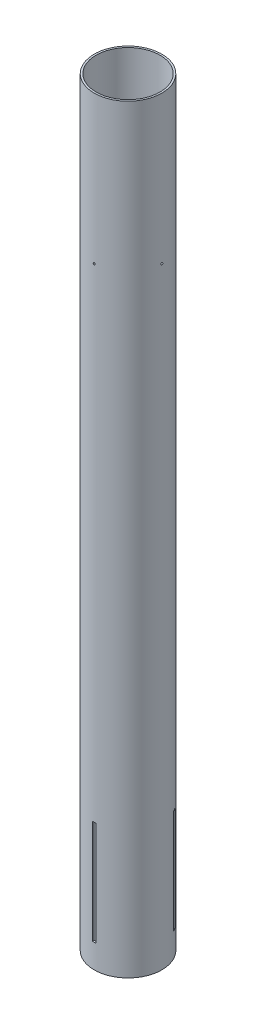
from build123d import *

# Parameters (mm, degrees)
SKETCH1_R                 = 53.721
SKETCH1_R_2               = 50.8
BODY_TUBE_EXTRUSION_DEPTH = 1206.5
ENGINE_BLOCK_HOLE_REACH   = 1214.465
SKETCH2_R                 = 1.6383
CIRPATTERN1_COUNT         = 4
SKETCH3_W                 = 5.334
SKETCH3_H                 = 165.1
FIN_TAB_SLOTS_DEPTH       = 2.54
CIRPATTERN2_COUNT         = 3


with BuildPart() as part:
    # Sketch1 → Body Tube Extrusion (new body)
    with BuildSketch(Plane(origin=(0, 0, 0), x_dir=(1, 0, 0), z_dir=(0, 1, 0))):
        Circle(SKETCH1_R)
        Circle(SKETCH1_R_2, mode=Mode.SUBTRACT)
    extrude(amount=BODY_TUBE_EXTRUSION_DEPTH)

    # Sketch2 → Engine Block Hole (cut, up to next)
    with BuildSketch(Plane.XY.offset(53.721), mode=Mode.PRIVATE) as engine_block_hole_sk1:
        with Locations((0, 971.55)):
            Circle(SKETCH2_R)
    engine_block_hole_tool1 = extrude(engine_block_hole_sk1.sketch, amount=-ENGINE_BLOCK_HOLE_REACH, mode=Mode.PRIVATE) & part.part
    engine_block_hole = engine_block_hole_tool1.solids().sort_by_distance((0, 971.55, 53.721))[0]
    add(engine_block_hole, mode=Mode.SUBTRACT)

    # CirPattern1: Engine Block Hole ×4 about axis
    cirpattern1_axis = Axis((0, 1206.5, 0), (0, -1, 0))
    for i in range(1, CIRPATTERN1_COUNT):
        add(engine_block_hole.rotate(cirpattern1_axis, i * 360 / CIRPATTERN1_COUNT), mode=Mode.SUBTRACT)

    # Sketch3 → Fin Tab Slots (cut)
    with BuildSketch(Plane.XY.offset(53.721)):
        with Locations((0, 120.65)):
            Rectangle(SKETCH3_W, SKETCH3_H)
    fin_tab_slots = extrude(amount=-FIN_TAB_SLOTS_DEPTH, mode=Mode.SUBTRACT)

    # CirPattern2: Fin Tab Slots ×3 about axis
    cirpattern2_axis = Axis((0, 1206.5, 0), (0, -1, 0))
    for i in range(1, CIRPATTERN2_COUNT):
        add(fin_tab_slots.rotate(cirpattern2_axis, i * 360 / CIRPATTERN2_COUNT), mode=Mode.SUBTRACT)


solid = part.part
